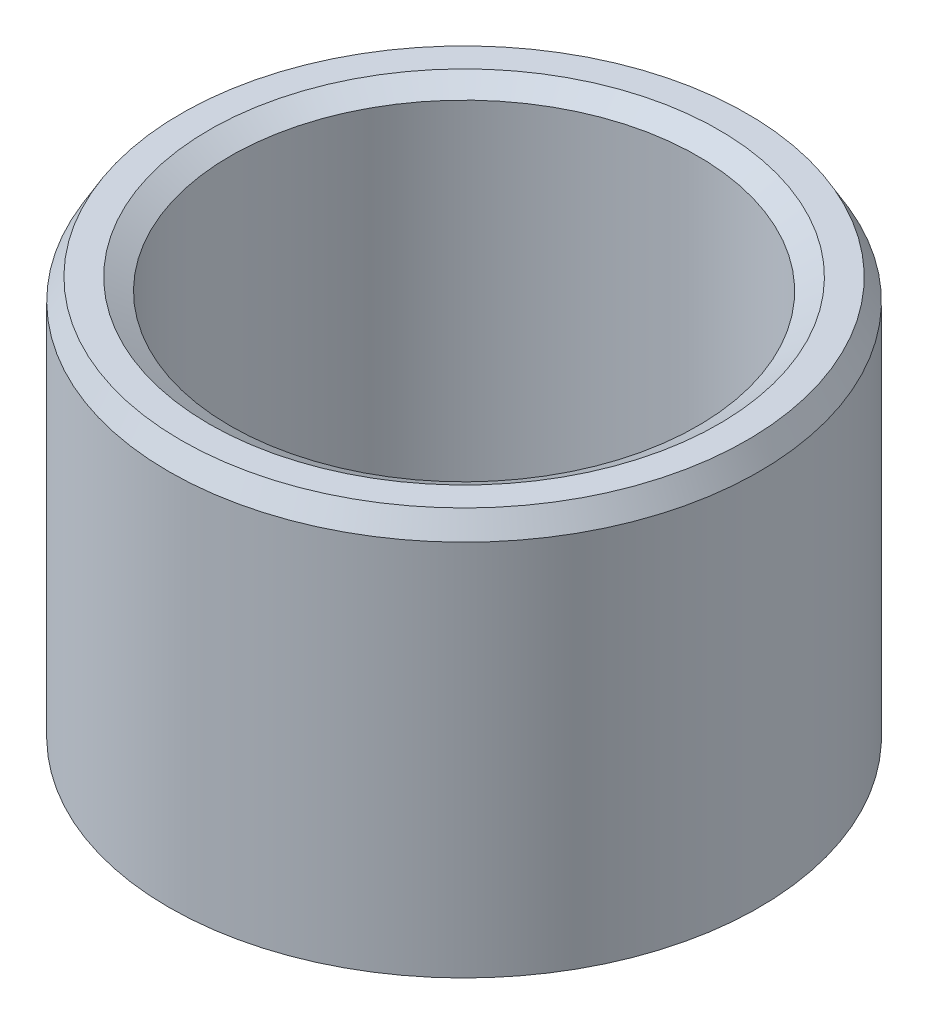
from build123d import *
from OCP.BRepFilletAPI import BRepFilletAPI_MakeChamfer

# Parameters (mm, degrees)
SKETCH1_R           = 45
BOSS_EXTRUDE1_DEPTH = 62.610233873
SKETCH2_R           = 35.644300691
CUT_EXTRUDE1_DEPTH  = 90.27508827
CHAMFER1_SIZE       = 3.211135242
CHAMFER1_SIZE2      = 1.853949796


with BuildPart() as part:
    # Sketch1 → Boss-Extrude1 (new body)
    with BuildSketch(Plane(origin=(0, 0, 0), x_dir=(1, 0, 0), z_dir=(0, 1, 0))):
        Circle(SKETCH1_R)
    extrude(amount=BOSS_EXTRUDE1_DEPTH)

    # Sketch2 → Cut-Extrude1 (cut, through all)
    with BuildSketch(Plane(origin=(0, 0, 0), x_dir=(1, 0, 0), z_dir=(0, 1, 0))):
        Circle(SKETCH2_R)
    extrude(amount=CUT_EXTRUDE1_DEPTH, mode=Mode.SUBTRACT)

    # Chamfer1: one chamfer whose edges measure the first distance from different faces: ONE call of the kernel's chamfer builder (chamfer() names one face for all edges)
    chamfer1_edges_1 = [part.edges().sort_by_distance(p)[0] for p in [
        (-35.644300691, 62.610233873, 0),
    ]]
    chamfer1_side_1 = [part.faces().sort_by_distance(p)[0] for p in [
        (-43.727207794, 62.610233873, 0),
    ]]
    chamfer1_edges_2 = [part.edges().sort_by_distance(p)[0] for p in [
        (-35.644300691, 0, 0),
    ]]
    chamfer1_side_2 = [part.faces().sort_by_distance(p)[0] for p in [
        (-35.644300691, 31.305116937, 0),
    ]]
    chamfer1_edges_3 = [part.edges().sort_by_distance(p)[0] for p in [
        (-45, 0, 0),
    ]]
    chamfer1_side_3 = [part.faces().sort_by_distance(p)[0] for p in [
        (-43.727207794, 0, 0),
    ]]
    chamfer1_edges_4 = [part.edges().sort_by_distance(p)[0] for p in [
        (-45, 62.610233873, 0),
    ]]
    chamfer1_side_4 = [part.faces().sort_by_distance(p)[0] for p in [
        (-45, 31.305116937, 0),
    ]]
    chamfer1 = BRepFilletAPI_MakeChamfer(part.part.solid().wrapped)
    for e in chamfer1_edges_1:
        chamfer1.Add(CHAMFER1_SIZE, CHAMFER1_SIZE2, e.wrapped, chamfer1_side_1[0].wrapped)  # the first distance lies on this face
    for e in chamfer1_edges_2:
        chamfer1.Add(CHAMFER1_SIZE, CHAMFER1_SIZE2, e.wrapped, chamfer1_side_2[0].wrapped)  # the first distance lies on this face
    for e in chamfer1_edges_3:
        chamfer1.Add(CHAMFER1_SIZE, CHAMFER1_SIZE2, e.wrapped, chamfer1_side_3[0].wrapped)  # the first distance lies on this face
    for e in chamfer1_edges_4:
        chamfer1.Add(CHAMFER1_SIZE, CHAMFER1_SIZE2, e.wrapped, chamfer1_side_4[0].wrapped)  # the first distance lies on this face
    add(Compound.cast(chamfer1.Shape()), mode=Mode.REPLACE)


solid = part.part
